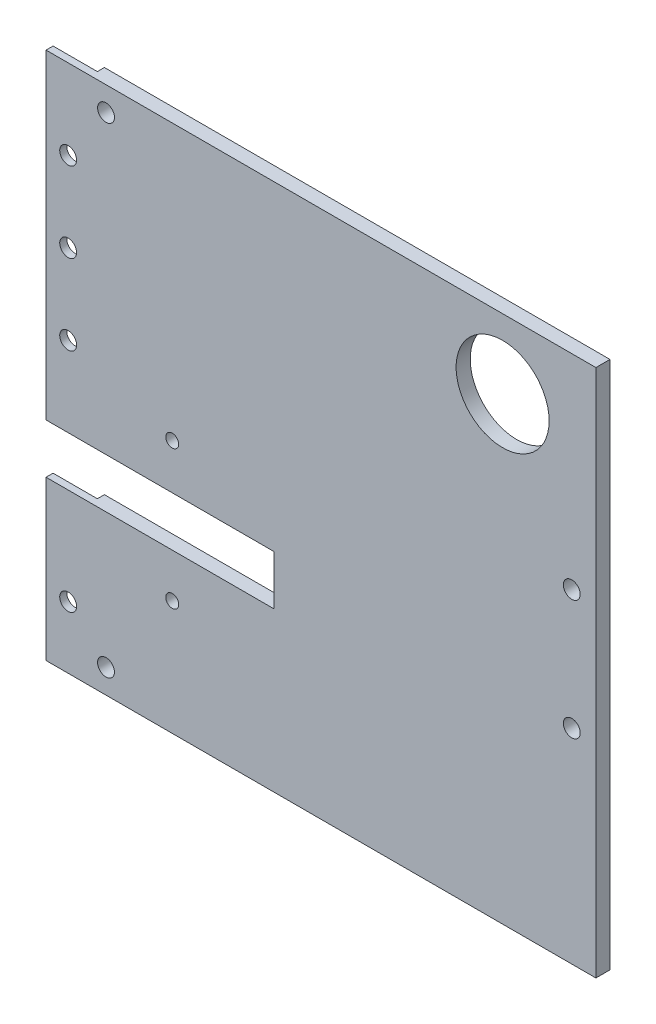
from build123d import *
from OCP.BRepAlgoAPI import BRepAlgoAPI_Cut
from OCP.TopTools import TopTools_ListOfShape

# Parameters (mm, degrees)
SKETCH2_W           = 124.17
SKETCH2_H           = 119.38
BOSS_EXTRUDE1_DEPTH = 3.18
SKETCH3_R           = 1.46
SKETCH3_R_2         = 1.905
SKETCH3_R_3         = 10.5
SKETCH3_W           = 51.5
SKETCH3_H           = 11.2
CUT_EXTRUDE1_DEPTH  = 23.18
SKETCH5_W           = 1.59
SKETCH5_H           = 120
CUT_EXTRUDE2_DEPTH  = 10
SKETCH6_R           = 1.905
CUT_EXTRUDE3_DEPTH  = 10


with BuildPart() as part:
    # Sketch2 → Boss-Extrude1 (new body)
    with BuildSketch(Plane(origin=(0, -1.061487407, 0), x_dir=(1, 0, 0), z_dir=(0, 0, 1))):
        with Locations((0.708693295, -25.828343308)):
            Rectangle(SKETCH2_W, SKETCH2_H)
    extrude(amount=BOSS_EXTRUDE1_DEPTH)

    # Sketch3 → Cut-Extrude1 (cut)
    with BuildSketch(Plane.XY):
        with Locations((-32.876306705, -60.668830715)):
            Circle(SKETCH3_R)
        with Locations((-32.876306705, -29.318830715)):
            Circle(SKETCH3_R)
        with Locations((-47.826306705, 27.348169285)):
            Circle(SKETCH3_R_2)
        with Locations((41.729693295, 17.090169285)):
            Circle(SKETCH3_R_3)
        with Locations((-47.826306705, -81.127830715)):
            Circle(SKETCH3_R_2)
        with Locations((57.343693295, -13.339830715)):
            Circle(SKETCH3_R_2)
        with Locations((57.343693295, -40.439830715)):
            Circle(SKETCH3_R_2)
        with Locations((-35.626306705, -45.132830715)):
            Rectangle(SKETCH3_W, SKETCH3_H)
    extrude(amount=CUT_EXTRUDE1_DEPTH, mode=Mode.SUBTRACT)


with BuildPart() as cut_extrude2_tool:
    # Sketch5 → Cut-Extrude2 (new body)
    with BuildSketch(Plane.ZY.offset(61.376306705)):
        with Locations((0.794999799, -27.199831736)):
            Rectangle(SKETCH5_W, SKETCH5_H)
    extrude(amount=-CUT_EXTRUDE2_DEPTH)


with BuildPart() as part_1:
    add(part.part)

    # Cut-Extrude2: cut by cut_extrude2_tool, with a tolerance
    cut_extrude2_stock = TopTools_ListOfShape()
    cut_extrude2_stock.Append(part_1.part.wrapped)
    cut_extrude2_tools = TopTools_ListOfShape()
    cut_extrude2_tools.Append(cut_extrude2_tool.part.wrapped)
    cut_extrude2_cut = BRepAlgoAPI_Cut()
    cut_extrude2_cut.SetArguments(cut_extrude2_stock)
    cut_extrude2_cut.SetTools(cut_extrude2_tools)
    cut_extrude2_cut.SetFuzzyValue(0.00001)
    cut_extrude2_cut.Build()
    add(Compound.cast(cut_extrude2_cut.Shape()).solids(), mode=Mode.REPLACE)

    # Sketch6 → Cut-Extrude3 (cut)
    with BuildSketch(Plane(origin=(0, 0, 1.589999799), x_dir=(-1, 0, 0), z_dir=(0, 0, -1))):
        with Locations((56.376306705, 14.720168264)):
            Circle(SKETCH6_R)
        with Locations((56.376306705, -3.369831736)):
            Circle(SKETCH6_R)
        with Locations((56.376306705, -21.452830715)):
            Circle(SKETCH6_R)
        with Locations((56.376306705, -72.579830715)):
            Circle(SKETCH6_R)
    extrude(amount=-CUT_EXTRUDE3_DEPTH, mode=Mode.SUBTRACT)


solid = part_1.part
